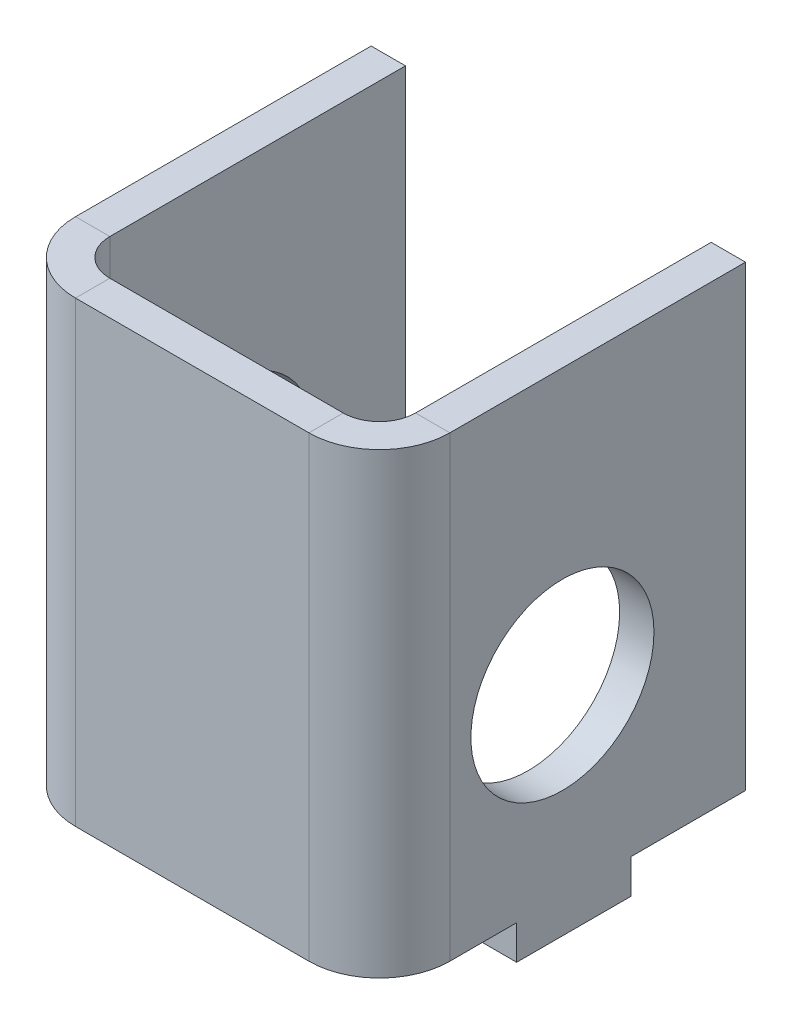
from build123d import *

# Parameters (mm, degrees)
BASE_FLANGE1_DEPTH      = 25.4
SKETCH6_R               = 5.08
CUT_EXTRUDE1_DEPTH      = 838.117118208
BOSS_EXTRUDE1_OUTLINE_W = 1.905
BOSS_EXTRUDE1_OUTLINE_H = 6.35
BOSS_EXTRUDE1_DEPTH     = 1.905


# Read off the part's stored shape, not the designer's step: Boss-Extrude1
# Sheet-metal steps are written as plain solids
with BuildPart() as part:
    # Sketch1 → Base-Flange1 (new body)
    with BuildSketch(Plane(origin=(0, 836.6125, -836.6125), x_dir=(1, 0, 0), z_dir=(0, -1, 0))):
        with BuildLine():
            Line((432.5239, 836.6125), (432.5239, 853.0209))
            ThreePointArc((432.5239, 853.0209), (433.669581115, 855.786818885), (436.4355, 856.9325))
            Line((436.4355, 856.9325), (449.3895, 856.9325))
            ThreePointArc((449.3895, 856.9325), (452.155418885, 855.786818885), (453.3011, 853.0209))
            Line((453.3011, 853.0209), (453.3011, 836.6125))
            Line((453.3011, 836.6125), (451.3961, 836.6125))
            Line((451.3961, 836.6125), (451.3961, 853.0209))
            ThreePointArc((451.3961, 853.0209), (450.808380467, 854.439780467), (449.3895, 855.0275))
            Line((449.3895, 855.0275), (436.4355, 855.0275))
            ThreePointArc((436.4355, 855.0275), (435.016619533, 854.439780467), (434.4289, 853.0209))
            Line((434.4289, 853.0209), (434.4289, 836.6125))
            Line((434.4289, 836.6125), (432.5239, 836.6125))
        make_face()
    extrude(amount=BASE_FLANGE1_DEPTH)

    # Sketch6 → Cut-Extrude1 (cut, through all)
    with BuildSketch(Plane(origin=(453.3011, 0, 0), x_dir=(0, 0, -1), z_dir=(1, 0, 0))):
        with Locations((-10.16, 821.3725)):
            Circle(SKETCH6_R)
    extrude(amount=-CUT_EXTRUDE1_DEPTH, mode=Mode.SUBTRACT)

    # Boss-Extrude1 outline → Boss-Extrude1 (add)
    with BuildSketch(Plane.XZ.offset(-811.2125)):
        with Locations((452.3486, 9.525)):
            Rectangle(BOSS_EXTRUDE1_OUTLINE_W, BOSS_EXTRUDE1_OUTLINE_H)
        with Locations((433.4764, 9.525)):
            Rectangle(BOSS_EXTRUDE1_OUTLINE_W, BOSS_EXTRUDE1_OUTLINE_H)
    extrude(amount=BOSS_EXTRUDE1_DEPTH)


solid = part.part
